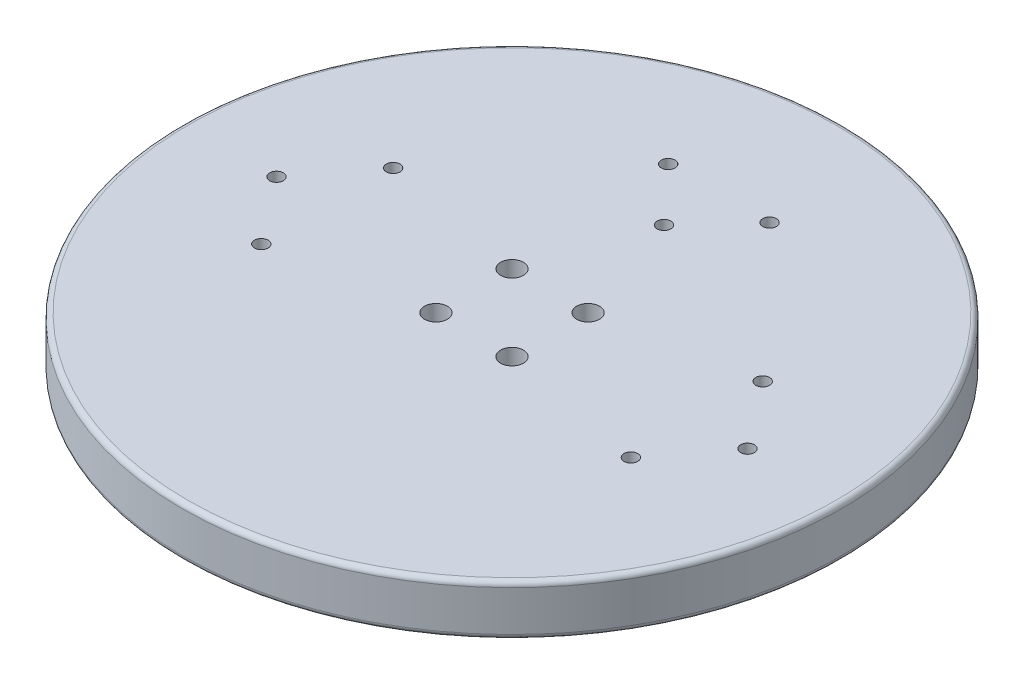
from build123d import *

# Parameters (mm, degrees)
SKETCH1_R             = 65
BOSS_EXTRUDE1_DEPTH   = 10
FILLET1_R             = 1
F_6_32_TAPPED_HOLE1_D = 2.7051
F_8_CLEARANCE_HOLE1_D = 4.4958


with BuildPart() as part:
    # Sketch1 → Boss-Extrude1 (new body)
    with BuildSketch(Plane(origin=(0, 0, 0), x_dir=(1, 0, 0), z_dir=(0, 1, 0))):
        Circle(SKETCH1_R)
    extrude(amount=BOSS_EXTRUDE1_DEPTH)

    # Fillet1
    fillet1_edges = [part.edges().sort_by_distance(p)[0] for p in [
        (-65, 0, 0),
        (-65, 10, 0),
    ]]
    fillet(fillet1_edges, radius=FILLET1_R)

    # #6-32 Tapped Hole1 (through all)
    with Locations(Plane.XZ):
        with Locations((-46.445, 0), (46.445, 0), (-36.445, -13), (-36.445, 13), (36.445, 13), (36.445, -13), (10.00119449, -40.8), (0.00119449, -29.978097245), (-9.99880551, -40.8)):
            Hole(F_6_32_TAPPED_HOLE1_D / 2)

    # #8 Clearance Hole1 (through all)
    with Locations(Plane(origin=(0, 0, 0), x_dir=(-1, 0, 0), z_dir=(0, -1, 0))):
        with Locations((7.5, -7.5), (-7.5, -7.5), (7.5, 7.5), (-7.5, 7.5)):
            Hole(F_8_CLEARANCE_HOLE1_D / 2)


solid = part.part
